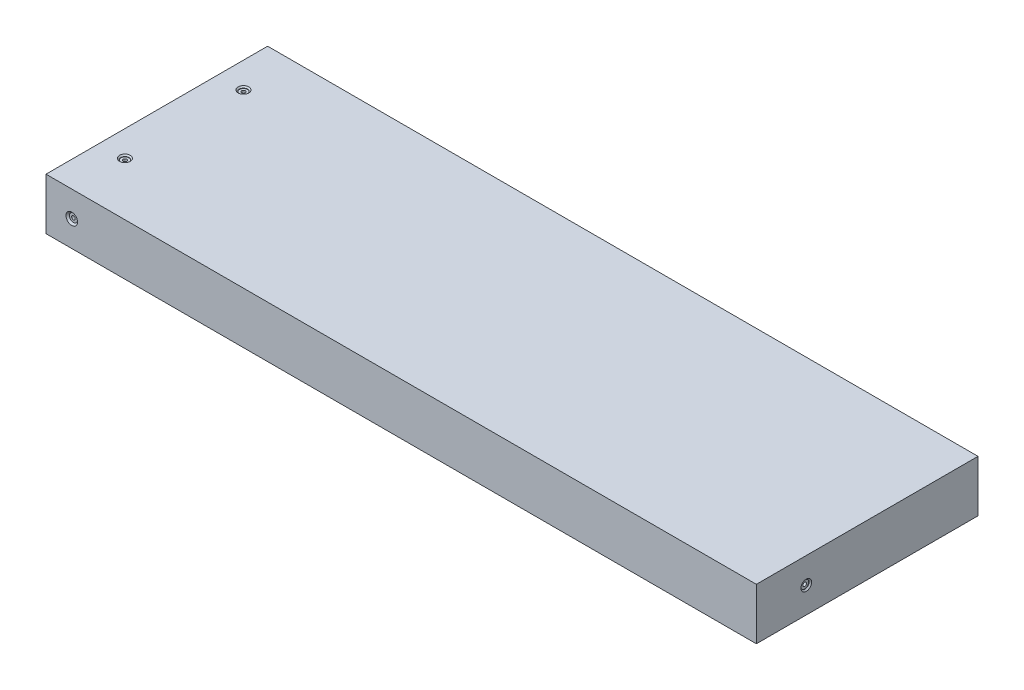
from build123d import *

# Parameters (mm, degrees)
SKETCH1_W                                   = 350
SKETCH1_H                                   = 109.2
BOSS_EXTRUDE1_DEPTH                         = 25.4
CBORE_FOR_0_BINDING_HEAD_MACHINE_SC_2_COUNT = 2
CBORE_FOR_0_BINDING_HEAD_MACHINE_SC_2_PITCH = 58.4
CBORE_FOR_0_BINDING_HEAD_MACHINE_SC_3_COUNT = 2
CBORE_FOR_0_BINDING_HEAD_MACHINE_SC_3_PITCH = 58.4


with BuildPart() as part:
    # Sketch1 → Boss-Extrude1 (new body)
    with BuildSketch(Plane(origin=(0, 0, 0), x_dir=(1, 0, 0), z_dir=(0, 1, 0))):
        Rectangle(SKETCH1_W, SKETCH1_H)
    extrude(amount=BOSS_EXTRUDE1_DEPTH)

    # Sketch3 → CBORE for #0 Binding Head Machine Screw1 (revolve, cut)
    with BuildSketch(Plane(origin=(-162.3, 12.7, 54.6), x_dir=(0, -1, 0), z_dir=(1, 0, 0))):
        Polygon((0, 0), (0, 30.53416509), (0.889, 30), (0.889, 0.8128), (1.98501, 0.8128), (1.98501, 0.87249), (2.8575, 0), align=None)
    cbore_for_0_binding_head_machine_screw1 = revolve(axis=Axis((-162.3, 12.7, 60.95), (0, 0, -1)), mode=Mode.SUBTRACT)

    # Mirror1: CBORE for #0 Binding Head Machine Screw1 across plane
    add(cbore_for_0_binding_head_machine_screw1.mirror(Plane.XY), mode=Mode.SUBTRACT)

    # Sketch5 → CBORE for #0 Binding Head Machine Screw2 (revolve, cut)
    with BuildSketch(Plane(origin=(175, -45.7, 30), x_dir=(0, 0, -1), z_dir=(0, 1, 0))):
        Polygon((0, 0), (0, 30.53416509), (0.889, 30), (0.889, 0.8128), (1.98501, 0.8128), (1.98501, 0.635), (2.62001, 0), align=None)
    cbore_for_0_binding_head_machine_screw2 = revolve(axis=Axis((181.35, -45.7, 30), (-1, 0, 0)), mode=Mode.SUBTRACT)

    # CBORE for _0 Binding Head Machine Sc 2: CBORE for #0 Binding Head Machine Screw2 ×2
    with Locations(*[(0, i * CBORE_FOR_0_BINDING_HEAD_MACHINE_SC_2_PITCH, 0) for i in range(1, CBORE_FOR_0_BINDING_HEAD_MACHINE_SC_2_COUNT)]):
        add(cbore_for_0_binding_head_machine_screw2, mode=Mode.SUBTRACT)

    # Sketch7 → CBORE for #0 Binding Head Machine Screw3 (revolve, cut)
    with BuildSketch(Plane(origin=(-162.3, 25.4, -30), x_dir=(0, 0, 1), z_dir=(1, 0, 0))):
        Polygon((0, 0), (0, 30.53416509), (0.889, 30), (0.889, 0.8128), (1.98501, 0.8128), (1.98501, 0.635), (2.62001, 0), align=None)
    cbore_for_0_binding_head_machine_screw3 = revolve(axis=Axis((-162.3, 31.75, -30), (0, -1, 0)), mode=Mode.SUBTRACT)

    # CBORE for _0 Binding Head Machine Sc 3: CBORE for #0 Binding Head Machine Screw3 ×2
    with Locations(*[(0, 0, i * CBORE_FOR_0_BINDING_HEAD_MACHINE_SC_3_PITCH) for i in range(1, CBORE_FOR_0_BINDING_HEAD_MACHINE_SC_3_COUNT)]):
        add(cbore_for_0_binding_head_machine_screw3, mode=Mode.SUBTRACT)


solid = part.part
